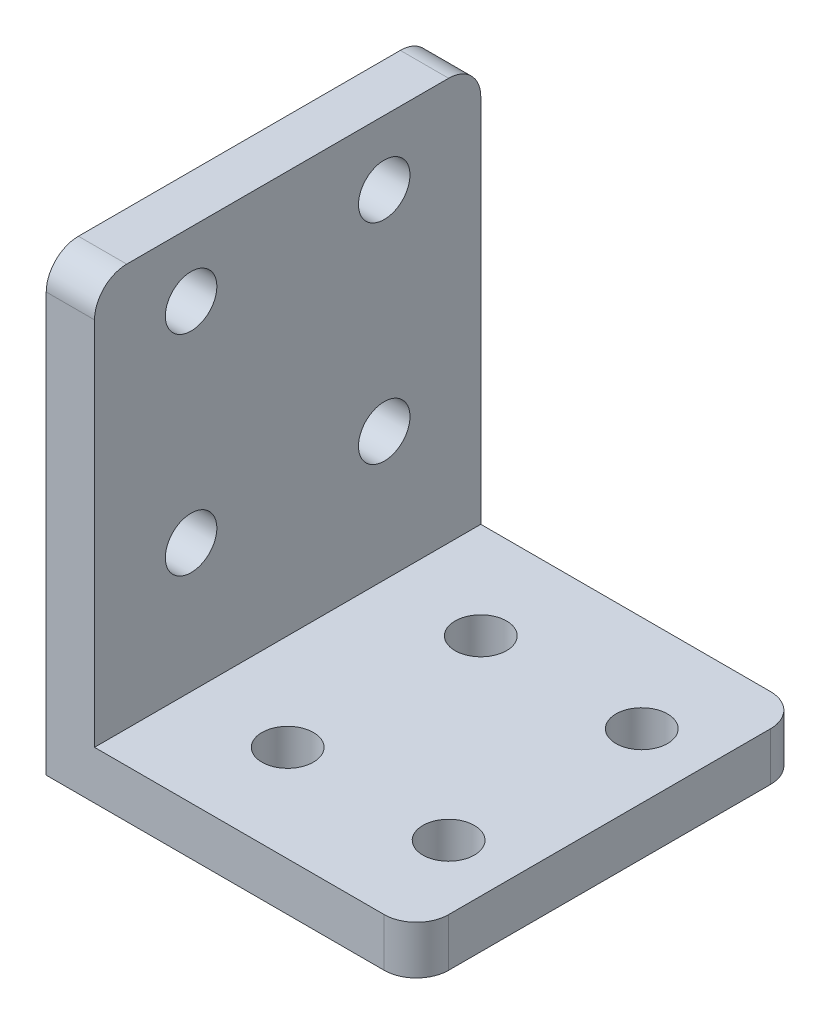
from build123d import *

# Parameters (mm, degrees)
EXTRUDE_1_DEPTH     = 24
SKETCH_2_R          = 1.6
CUT_EXTRUDE_1_DEPTH = 24
SKETCH_3_R          = 1.6
CUT_EXTRUDE_2_DEPTH = 24
FILLET_1_R          = 2
SKETCH_4_R          = 1.6
CUT_EXTRUDE_3_DEPTH = 4
SKETCH_5_R          = 1.6
CUT_EXTRUDE_4_DEPTH = 4


with BuildPart() as part:
    # 草图1 → 凸台-拉伸1 (new body)
    with BuildSketch(Plane.XY):
        Polygon((6, 129.691622655), (3, 129.691622655), (3, 101.691622655), (26, 101.691622655), (26, 104.691622655), (6, 104.691622655), align=None)
    extrude(amount=-EXTRUDE_1_DEPTH)

    # 草图2 → 切除-拉伸1 (cut)
    with BuildSketch(Plane(origin=(6, 0, 0), x_dir=(0, 0, -1), z_dir=(1, 0, 0))):
        with Locations((6, 125.691622655)):
            Circle(SKETCH_2_R)
        with Locations((18, 125.691622655)):
            Circle(SKETCH_2_R)
    extrude(amount=-CUT_EXTRUDE_1_DEPTH, mode=Mode.SUBTRACT)

    # 草图3 → 切除-拉伸2 (cut)
    with BuildSketch(Plane(origin=(0, 104.691622655, 0), x_dir=(1, 0, 0), z_dir=(0, 1, 0))):
        with Locations((22, 6)):
            Circle(SKETCH_3_R)
        with Locations((22, 18)):
            Circle(SKETCH_3_R)
    extrude(amount=-CUT_EXTRUDE_2_DEPTH, mode=Mode.SUBTRACT)

    # 圆角1
    fillet_1_edges = [part.edges().sort_by_distance(p)[0] for p in [
        (26, 103.191622655, -24),
        (26, 103.191622655, 0),
        (4.5, 129.691622655, -24),
        (4.5, 129.691622655, 0),
    ]]
    fillet(fillet_1_edges, radius=FILLET_1_R)

    # 草图4 → 切除-拉伸3 (cut)
    with BuildSketch(Plane.ZY.offset(-3)):
        with Locations((-18, 112.691622655)):
            Circle(SKETCH_4_R)
        with Locations((-6, 112.691622655)):
            Circle(SKETCH_4_R)
    extrude(amount=-CUT_EXTRUDE_3_DEPTH, mode=Mode.SUBTRACT)

    # 草图5 → 切除-拉伸4 (cut)
    with BuildSketch(Plane(origin=(0, 104.691622655, 0), x_dir=(1, 0, 0), z_dir=(0, 1, 0))):
        with Locations((12, 18)):
            Circle(SKETCH_5_R)
        with Locations((12, 6)):
            Circle(SKETCH_5_R)
    extrude(amount=-CUT_EXTRUDE_4_DEPTH, mode=Mode.SUBTRACT)


solid = part.part
